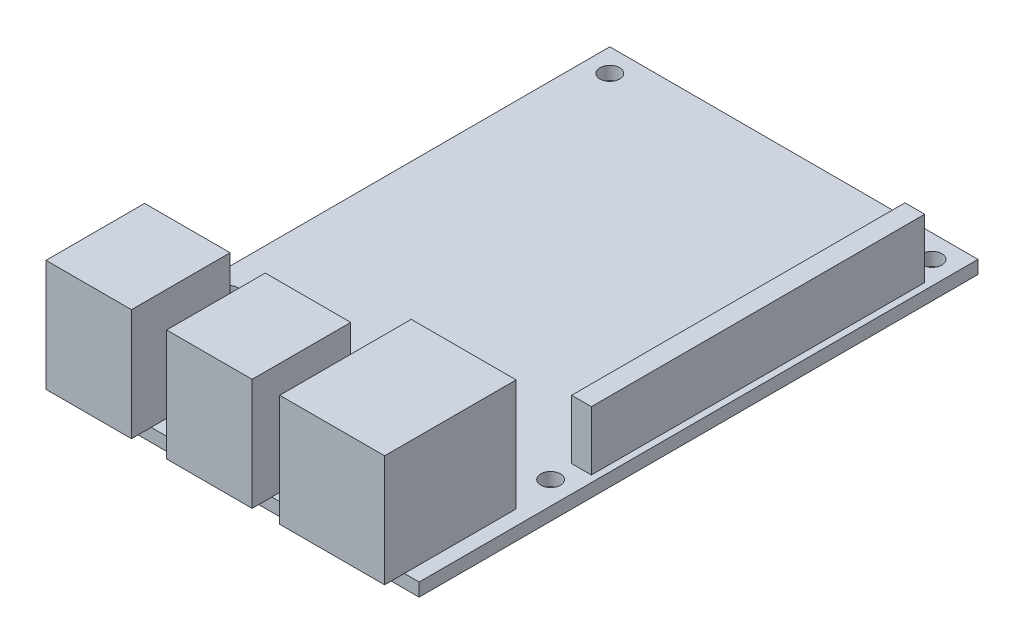
from build123d import *

# Parameters (mm, degrees)
SKETCH1_W           = 56
SKETCH1_H           = 85
SKETCH1_R           = 1.5
BOSS_EXTRUDE1_DEPTH = 2
SKETCH2_W           = 3
SKETCH2_H           = 50.7
BOSS_EXTRUDE2_DEPTH = 9
SKETCH3_W           = 13
SKETCH3_H           = 15
SKETCH3_W_2         = 15.95
SKETCH3_H_2         = 20
BOSS_EXTRUDE3_DEPTH = 17


with BuildPart() as part:
    # Sketch1 → Boss-Extrude1 (new body)
    with BuildSketch(Plane(origin=(0, 0, 0), x_dir=(1, 0, 0), z_dir=(0, 1, 0))):
        Rectangle(SKETCH1_W, SKETCH1_H)
        with Locations((-24.5, 39)):
            Circle(SKETCH1_R, mode=Mode.SUBTRACT)
        with Locations((24.5, 39)):
            Circle(SKETCH1_R, mode=Mode.SUBTRACT)
        with Locations((-24.5, -19)):
            Circle(SKETCH1_R, mode=Mode.SUBTRACT)
        with Locations((24.5, -19)):
            Circle(SKETCH1_R, mode=Mode.SUBTRACT)
    extrude(amount=BOSS_EXTRUDE1_DEPTH)

    # Sketch2 → Boss-Extrude2 (add)
    with BuildSketch(Plane(origin=(0, 2, 0), x_dir=(1, 0, 0), z_dir=(0, 1, 0))):
        with Locations((25.5, 10.05)):
            Rectangle(SKETCH2_W, SKETCH2_H)
    extrude(amount=BOSS_EXTRUDE2_DEPTH)

    # Sketch3 → Boss-Extrude3 (add)
    with BuildSketch(Plane(origin=(0, 2, 0), x_dir=(1, 0, 0), z_dir=(0, 1, 0))):
        with Locations((-19.25, -38)):
            Rectangle(SKETCH3_W, SKETCH3_H)
        with Locations((-0.9, -38)):
            Rectangle(SKETCH3_W, SKETCH3_H)
        with Locations((17.775, -35.5)):
            Rectangle(SKETCH3_W_2, SKETCH3_H_2)
    extrude(amount=BOSS_EXTRUDE3_DEPTH)


solid = part.part
